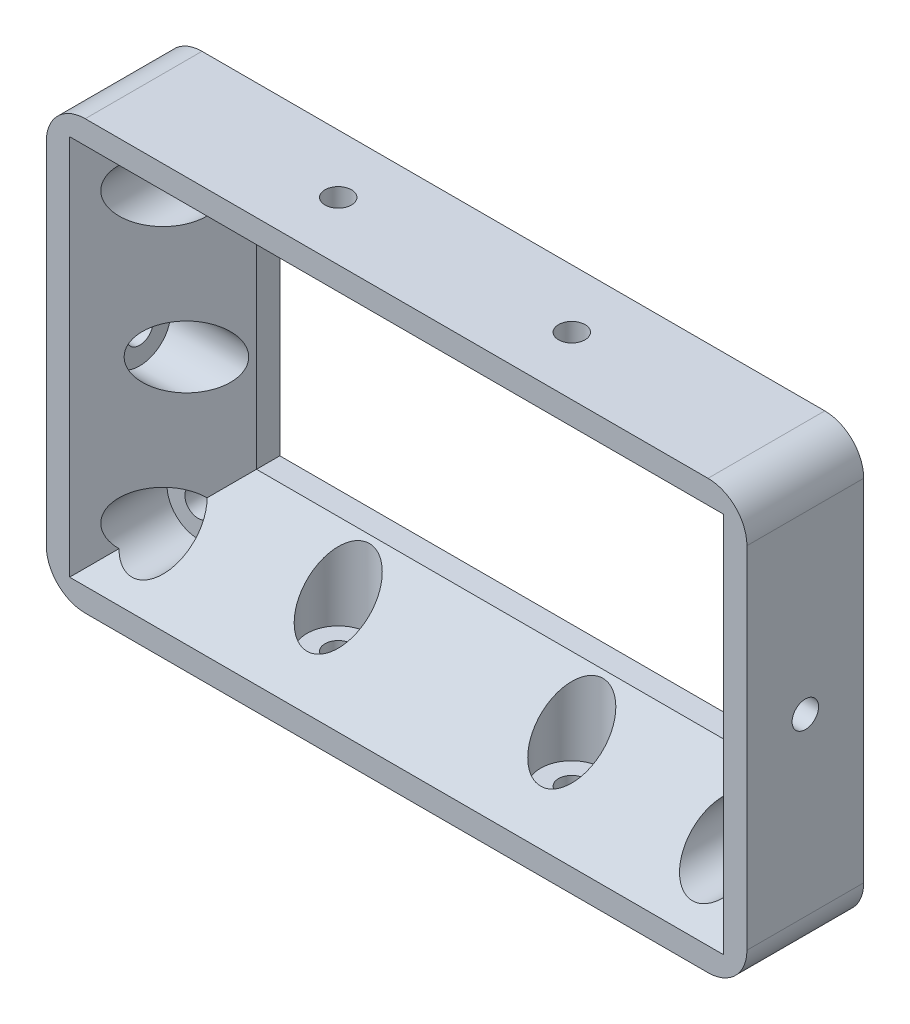
from build123d import *

# Parameters (mm, degrees)
SKETCH1_W                       = 90
SKETCH1_H                       = 55
BOSS_EXTRUDE1_DEPTH             = 15
SKETCH2_W                       = 60
SKETCH2_H                       = 25
CUT_EXTRUDE1_DEPTH              = 55.829280499
CBORE_FOR_M3_SBHCS1_D           = 3.4
CBORE_FOR_M3_SBHCS1_CBORE_D     = 8
CBORE_FOR_M3_SBHCS1_CBORE_DEPTH = 10.5
FILLET7_R                       = 5
FILLET8_R                       = 5
FILLET9_R                       = 5
FILLET10_R                      = 5
CBORE_FOR_M3_SBHCS2_D           = 3.4
CBORE_FOR_M3_SBHCS2_DEPTH       = 15
CBORE_FOR_M3_SBHCS2_CBORE_D     = 8
CBORE_FOR_M3_SBHCS2_CBORE_DEPTH = 10.5
CBORE_FOR_M3_SBHCS6_D           = 3.4
CBORE_FOR_M3_SBHCS6_DEPTH       = 15
CBORE_FOR_M3_SBHCS6_CBORE_D     = 8
CBORE_FOR_M3_SBHCS6_CBORE_DEPTH = 10.5
CBORE_FOR_M3_SBHCS7_D           = 3.4
CBORE_FOR_M3_SBHCS7_DEPTH       = 15
CBORE_FOR_M3_SBHCS7_CBORE_D     = 8
CBORE_FOR_M3_SBHCS7_CBORE_DEPTH = 10.5
CBORE_FOR_M3_SBHCS8_D           = 3.4
CBORE_FOR_M3_SBHCS8_DEPTH       = 15
CBORE_FOR_M3_SBHCS8_CBORE_D     = 8
CBORE_FOR_M3_SBHCS8_CBORE_DEPTH = 10.5
CHAMFER5_SIZE                   = 12
CHAMFER7_SIZE                   = 12
CHAMFER8_SIZE                   = 12
CHAMFER9_SIZE                   = 12


with BuildPart() as part:
    # Sketch1 → Boss-Extrude1 (new body)
    with BuildSketch(Plane.XY):
        Rectangle(SKETCH1_W, SKETCH1_H)
    extrude(amount=BOSS_EXTRUDE1_DEPTH)

    # Sketch2 → Cut-Extrude1 (cut, through all)
    with BuildSketch(Plane.XY.offset(15)):
        Rectangle(SKETCH2_W, SKETCH2_H)
    extrude(amount=-CUT_EXTRUDE1_DEPTH, mode=Mode.SUBTRACT)

    # CBORE for M3 SBHCS1 (through all)
    with Locations(Plane.XY.offset(15)):
        with Locations((-36, -18.5), (-36, 18.5), (36, 18.5), (36, -18.5)):
            CounterBoreHole(CBORE_FOR_M3_SBHCS1_D / 2, CBORE_FOR_M3_SBHCS1_CBORE_D / 2, CBORE_FOR_M3_SBHCS1_CBORE_DEPTH)

    # Fillet7
    fillet7_edges = [part.edges().sort_by_distance(p)[0] for p in [
        (-45, -27.5, 7.5),
    ]]
    fillet(fillet7_edges, radius=FILLET7_R)

    # Fillet8
    fillet8_edges = [part.edges().sort_by_distance(p)[0] for p in [
        (-45, 27.5, 7.5),
    ]]
    fillet(fillet8_edges, radius=FILLET8_R)

    # Fillet9
    fillet9_edges = [part.edges().sort_by_distance(p)[0] for p in [
        (45, 27.5, 7.5),
    ]]
    fillet(fillet9_edges, radius=FILLET9_R)

    # Fillet10
    fillet10_edges = [part.edges().sort_by_distance(p)[0] for p in [
        (45, -27.5, 7.5),
    ]]
    fillet(fillet10_edges, radius=FILLET10_R)

    # CBORE for M3 SBHCS2
    with Locations(Plane(origin=(-30, 0, 0), x_dir=(0, 0, -1), z_dir=(1, 0, 0))):
        with Locations((-7.5, 0)):
            CounterBoreHole(CBORE_FOR_M3_SBHCS2_D / 2, CBORE_FOR_M3_SBHCS2_CBORE_D / 2, CBORE_FOR_M3_SBHCS2_CBORE_DEPTH, depth=CBORE_FOR_M3_SBHCS2_DEPTH)

    # CBORE for M3 SBHCS6
    with Locations(Plane(origin=(0, -12.5, 0), x_dir=(1, 0, 0), z_dir=(0, 1, 0))):
        with Locations((-15, -7.5), (15, -7.5)):
            CounterBoreHole(CBORE_FOR_M3_SBHCS6_D / 2, CBORE_FOR_M3_SBHCS6_CBORE_D / 2, CBORE_FOR_M3_SBHCS6_CBORE_DEPTH, depth=CBORE_FOR_M3_SBHCS6_DEPTH)

    # CBORE for M3 SBHCS7
    with Locations(Plane(origin=(0, 12.5, 0), x_dir=(-1, 0, 0), z_dir=(0, -1, 0))):
        with Locations((15, -7.5), (-15, -7.5)):
            CounterBoreHole(CBORE_FOR_M3_SBHCS7_D / 2, CBORE_FOR_M3_SBHCS7_CBORE_D / 2, CBORE_FOR_M3_SBHCS7_CBORE_DEPTH, depth=CBORE_FOR_M3_SBHCS7_DEPTH)

    # CBORE for M3 SBHCS8
    with Locations(Plane.ZY.offset(-30)):
        with Locations((7.5, 0)):
            CounterBoreHole(CBORE_FOR_M3_SBHCS8_D / 2, CBORE_FOR_M3_SBHCS8_CBORE_D / 2, CBORE_FOR_M3_SBHCS8_CBORE_DEPTH, depth=CBORE_FOR_M3_SBHCS8_DEPTH)

    # Chamfer5
    # the kernel refuses this chamfer: 12 mm, written as the material it takes off along each edge
    with BuildSketch(Plane(origin=(30, 12.5, 15), x_dir=(0, -0.027495876610586348, -0.9996219169112968), z_dir=(-1, 0, 0))) as chamfer5_piece_1:
        Polygon((CHAMFER5_SIZE * 0.999621916911, -CHAMFER5_SIZE * 0.0274958766106), (-CHAMFER5_SIZE * 0.0274958766106, -CHAMFER5_SIZE * 0.999621916911), (0, 0), align=None)
    extrude(amount=60, mode=Mode.SUBTRACT)

    # Chamfer7
    # the kernel refuses this chamfer: 12 mm, written as the material it takes off along each edge
    with BuildSketch(Plane(origin=(-30, -12.5, 15), x_dir=(0, -0.9996219169112969, 0.027495876610586348), z_dir=(1, 0, 0))) as chamfer7_piece_1:
        Polygon((CHAMFER7_SIZE * 0.999621916911, CHAMFER7_SIZE * 0.0274958766106), (-CHAMFER7_SIZE * 0.0274958766106, CHAMFER7_SIZE * 0.999621916911), (0, 0), align=None)
    extrude(amount=60, mode=Mode.SUBTRACT)

    # Chamfer8
    # the kernel refuses this chamfer: 12 mm, written as the material it takes off along each edge
    with BuildSketch(Plane(origin=(30, -55.360195856, 15), x_dir=(0.9996219169112969, 5.384635157726403e-15, 0.027495876610586355), z_dir=(0, 1, 0))) as chamfer8_piece_1_section:
        Polygon((CHAMFER8_SIZE * 0.999621916911, CHAMFER8_SIZE * 0.0274958766106), (-CHAMFER8_SIZE * 0.0274958766106, CHAMFER8_SIZE * 0.999621916911), (0, 0), align=None)
    chamfer8_piece_1 = extrude(amount=110.720391711, mode=Mode.PRIVATE)
    chamfer8_piece_1 = split(chamfer8_piece_1, bisect_by=Plane(origin=(33.163106807, 2.674956812, -6.825043188), z_dir=(0, -0.7071067811862648, 0.7071067811868302)), keep=Keep.TOP, mode=Mode.PRIVATE)
    chamfer8_piece_1 = split(chamfer8_piece_1, bisect_by=Plane(origin=(33.163106807, -18.33806362, 8.83806362), z_dir=(0, 0.7071067811868302, 0.7071067811862648)), keep=Keep.TOP, mode=Mode.PRIVATE)
    add(chamfer8_piece_1, mode=Mode.SUBTRACT)

    # Chamfer9
    # the kernel refuses this chamfer: 12 mm, written as the material it takes off along each edge
    with BuildSketch(Plane(origin=(-30, 55.360195856, 15), x_dir=(-0.9996219169112969, 5.384635157726403e-15, 0.027495876610586355), z_dir=(0, -1, 0))) as chamfer9_piece_1_section:
        Polygon((CHAMFER9_SIZE * 0.999621916911, CHAMFER9_SIZE * 0.0274958766106), (-CHAMFER9_SIZE * 0.0274958766106, CHAMFER9_SIZE * 0.999621916911), (0, 0), align=None)
    chamfer9_piece_1 = extrude(amount=110.720391711, mode=Mode.PRIVATE)
    chamfer9_piece_1 = split(chamfer9_piece_1, bisect_by=Plane(origin=(-33.163106802, 18.338063618, 8.838063618), z_dir=(0, -0.7071067811862648, 0.7071067811868302)), keep=Keep.TOP, mode=Mode.PRIVATE)
    chamfer9_piece_1 = split(chamfer9_piece_1, bisect_by=Plane(origin=(-33.163106802, -2.674956815, -6.825043185), z_dir=(0, 0.7071067811868302, 0.7071067811862648)), keep=Keep.TOP, mode=Mode.PRIVATE)
    add(chamfer9_piece_1, mode=Mode.SUBTRACT)


solid = part.part
